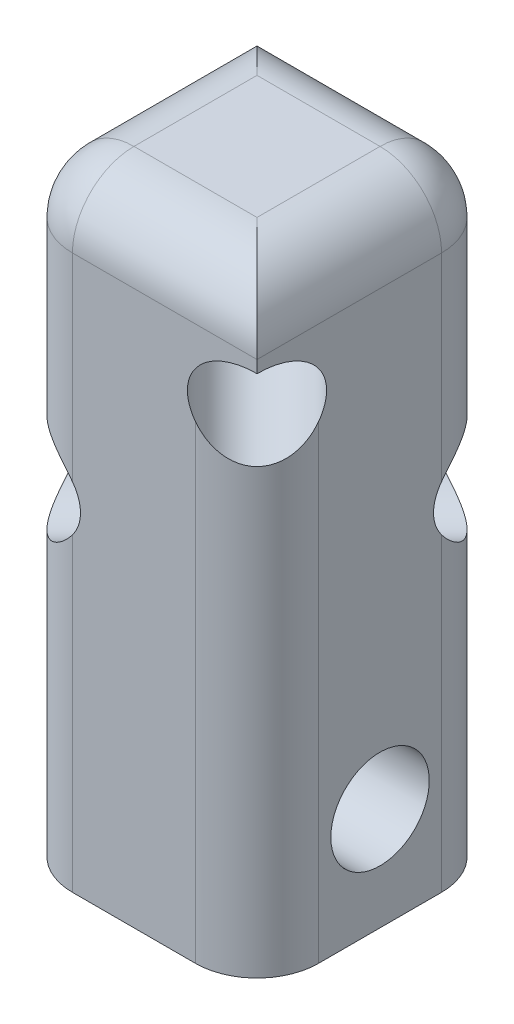
from build123d import *

# Parameters (mm, degrees)
SKETCH1_W           = 6
SKETCH1_H           = 6
BOSS_EXTRUDE1_DEPTH = 15
SKETCH2_R           = 1.2
CUT_EXTRUDE1_DEPTH  = 15
SKETCH3_R           = 1.2
CUT_EXTRUDE3_DEPTH  = 15
SKETCH4_R           = 1.2
CUT_EXTRUDE5_DEPTH  = 15
FILLET1_R           = 1.5


with BuildPart() as part:
    # Sketch1 → Boss-Extrude1 (new body)
    with BuildSketch(Plane(origin=(0, 0, 0), x_dir=(1, 0, 0), z_dir=(0, 1, 0))):
        Rectangle(SKETCH1_W, SKETCH1_H)
    extrude(amount=BOSS_EXTRUDE1_DEPTH)

    # Sketch2 → Cut-Extrude1 (cut)
    with BuildSketch(Plane.ZY.offset(3)):
        with Locations((0, 2.51)):
            Circle(SKETCH2_R)
    extrude(amount=-CUT_EXTRUDE1_DEPTH, mode=Mode.SUBTRACT)

    # Sketch3 → Cut-Extrude3 (cut)
    with BuildSketch(Plane(origin=(3, 0, 3), x_dir=(0.7071067811865475, 0, -0.7071067811865476), z_dir=(0.7071067811865476, 0, 0.7071067811865475))):
        with Locations((0, 12)):
            Circle(SKETCH3_R)
    extrude(amount=-CUT_EXTRUDE3_DEPTH, mode=Mode.SUBTRACT)

    # Sketch4 → Cut-Extrude5 (cut)
    with BuildSketch(Plane(origin=(-3, 0, 3), x_dir=(0.7071067811865475, 0, 0.7071067811865476), z_dir=(-0.7071067811865476, 0, 0.7071067811865475))):
        with Locations((0, 8.11)):
            Circle(SKETCH4_R)
    extrude(amount=-CUT_EXTRUDE5_DEPTH, mode=Mode.SUBTRACT)

    # Fillet1
    fillet1_edges = [part.edges().sort_by_distance(p)[0] for p in [
        (0, 15, 3),
        (-3, 15, 0),
        (0, 15, -3),
        (3, 15, 0),
        (-3, 12.155, 3),
        (-3, 3.455, 3),
        (3, 5.4, 3),
        (3, 3.455, -3),
        (3, 12.155, -3),
        (-3, 5.4, -3),
    ]]
    fillet(fillet1_edges, radius=FILLET1_R)


solid = part.part
